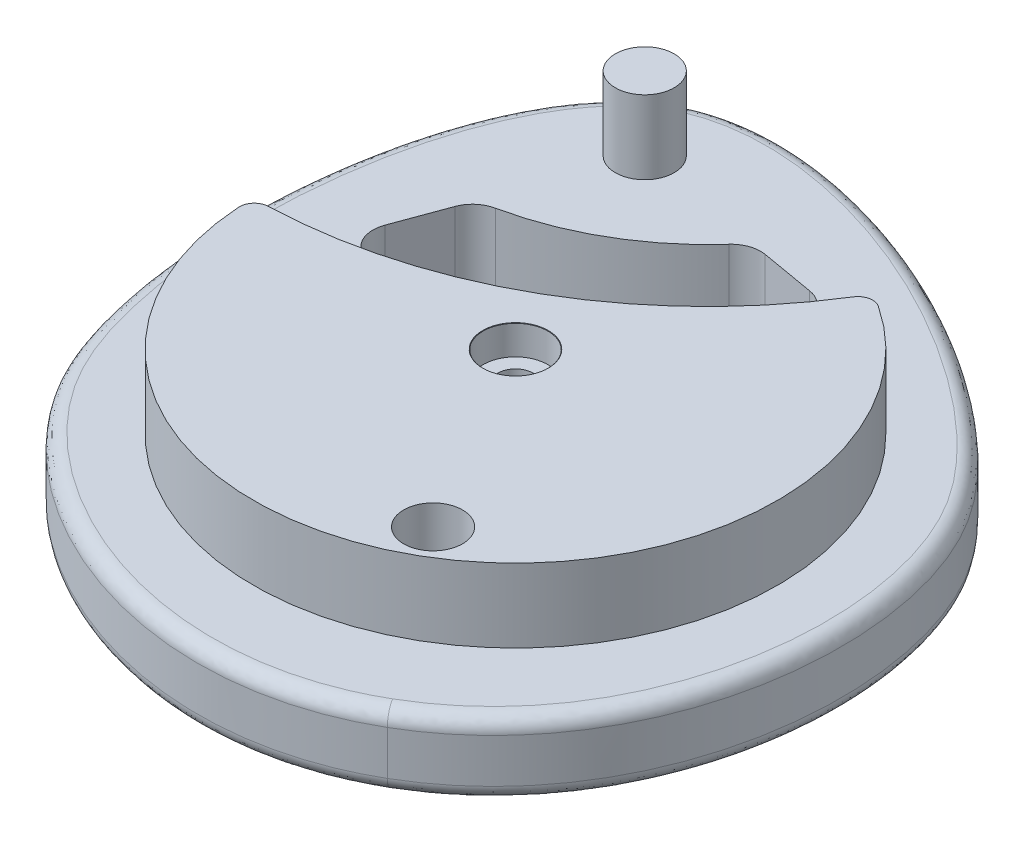
from build123d import *

# Parameters (mm, degrees)
BOSS_EXTRUDE1_DEPTH = 5
BOSS_EXTRUDE2_DEPTH = 5
SKETCH2_R           = 31
SKETCH2_R_2         = 2
CUT_EXTRUDE3_DEPTH  = 86.451740766
CUT_EXTRUDE4_DEPTH  = 77.058407391
FILLET1_R           = 2
SKETCH4_R           = 4.5
CUT_EXTRUDE7_DEPTH  = 4
FILLET2_R           = 1
FILLET5_R           = 1
FILLET6_R           = 1
CUT_EXTRUDE8_DEPTH  = 4


with BuildPart() as part:
    # Sketch1 → Boss-Extrude1 (new body)
    with BuildSketch(Plane(origin=(0, 0, 0), x_dir=(1, 0, 0), z_dir=(0, 1, 0))):
        with BuildLine():
            ThreePointArc((65.8, 0), (48, -17.8), (30.2, 0))
            Line((30.2, 0), (17, 0))
            ThreePointArc((17, 0), (48, -31), (79, 0))
            ThreePointArc((79, 0), (63.5, 26.846787517), (32.5, 26.846787517))
            Line((32.5, 26.846787517), (35, 22.516660498))
            ThreePointArc((35, 22.516660498), (37, 22.516660498), (38, 20.784609691))
            ThreePointArc((38, 20.784609691), (37.732050808, 19.784609691), (37, 19.052558883))
            Line((37, 19.052558883), (39.1, 15.415252187))
            ThreePointArc((39.1, 15.415252187), (48, 17.8), (56.9, 15.415252187))
            ThreePointArc((56.9, 15.415252187), (63.415252187, 8.9), (65.8, 0))
        make_face()
        with BuildLine():
            ThreePointArc((45.615252187, 4.130504375), (38.179521702, 1.050523962), (30.2, 0))
            Line((30.2, 0), (48, 0))
            Line((48, 0), (45.615252187, 4.130504375))
        make_face()
        with BuildLine():
            ThreePointArc((39.1, 15.415252187), (32.584747813, 8.9), (30.2, 0))
            ThreePointArc((30.2, 0), (38.179521702, 1.050523962), (45.615252187, 4.130504375))
            Line((45.615252187, 4.130504375), (39.1, 15.415252187))
        make_face()
        with BuildLine():
            ThreePointArc((56.9, 15.415252187), (48, 17.8), (39.1, 15.415252187))
            Line((39.1, 15.415252187), (45.615252187, 4.130504375))
            ThreePointArc((45.615252187, 4.130504375), (52.000458711, 9.030045664), (56.9, 15.415252187))
        make_face()
        with BuildLine():
            Line((48, 0), (30.2, 0))
            ThreePointArc((30.2, 0), (48, -17.8), (65.8, 0))
            ThreePointArc((65.8, 0), (63.415252187, 8.9), (56.9, 15.415252187))
            ThreePointArc((56.9, 15.415252187), (52.000458711, 9.030045664), (45.615252187, 4.130504375))
            Line((45.615252187, 4.130504375), (48, 0))
        make_face()
        with BuildLine():
            Line((30.2, 17.43597813), (30.2, 0))
            ThreePointArc((30.2, 0), (32.584747813, 8.9), (39.1, 15.415252187))
            Line((39.1, 15.415252187), (37, 19.052558883))
            ThreePointArc((37, 19.052558883), (35.48236191, 18.852758038), (34.267949192, 19.784609691))
            Line((34.267949192, 19.784609691), (30.2, 17.43597813))
        make_face()
        with BuildLine():
            Line((17, 0), (30.2, 0))
            Line((30.2, 0), (30.2, 17.43597813))
            Line((30.2, 17.43597813), (19.007354532, 10.973901256))
            ThreePointArc((19.007354532, 10.973901256), (17.505967719, 5.577992044), (17, 0))
        make_face()
        with BuildLine():
            Line((19.007354532, 10.973901256), (30.2, 17.43597813))
            Line((30.2, 17.43597813), (30.2, 25.380307327))
            ThreePointArc((30.2, 25.380307327), (23.51992542, 19.019094315), (19.007354532, 10.973901256))
        make_face()
        with BuildLine():
            Line((30.2, 25.380307327), (30.2, 17.43597813))
            Line((30.2, 17.43597813), (34.267949192, 19.784609691))
            ThreePointArc((34.267949192, 19.784609691), (34.068148347, 21.302247781), (35, 22.516660498))
            Line((35, 22.516660498), (32.5, 26.846787517))
            ThreePointArc((32.5, 26.846787517), (31.333862444, 26.138857262), (30.2, 25.380307327))
        make_face()
        with BuildLine():
            Line((36, 20.784609691), (37, 19.052558883))
            ThreePointArc((37, 19.052558883), (37.732050808, 19.784609691), (38, 20.784609691))
            ThreePointArc((38, 20.784609691), (37, 22.516660498), (35, 22.516660498))
            Line((35, 22.516660498), (36, 20.784609691))
        make_face()
        with BuildLine():
            ThreePointArc((35, 22.516660498), (34.068148347, 21.302247781), (34.267949192, 19.784609691))
            Line((34.267949192, 19.784609691), (36, 20.784609691))
            Line((36, 20.784609691), (35, 22.516660498))
        make_face()
        with BuildLine():
            Line((36, 20.784609691), (34.267949192, 19.784609691))
            ThreePointArc((34.267949192, 19.784609691), (35.48236191, 18.852758038), (37, 19.052558883))
            Line((37, 19.052558883), (36, 20.784609691))
        make_face()
    extrude(amount=-BOSS_EXTRUDE1_DEPTH)

    # Sketch1<3> → Boss-Extrude2 (add)
    with BuildSketch(Plane(origin=(0, 0, 0), x_dir=(1, 0, 0), z_dir=(0, 1, 0))):
        with BuildLine():
            Line((36, 20.784609691), (37, 19.052558883))
            ThreePointArc((37, 19.052558883), (37.732050808, 19.784609691), (38, 20.784609691))
            ThreePointArc((38, 20.784609691), (37, 22.516660498), (35, 22.516660498))
            Line((35, 22.516660498), (36, 20.784609691))
        make_face()
        with BuildLine():
            ThreePointArc((35, 22.516660498), (34.068148347, 21.302247781), (34.267949192, 19.784609691))
            Line((34.267949192, 19.784609691), (36, 20.784609691))
            Line((36, 20.784609691), (35, 22.516660498))
        make_face()
        with BuildLine():
            Line((36, 20.784609691), (34.267949192, 19.784609691))
            ThreePointArc((34.267949192, 19.784609691), (35.48236191, 18.852758038), (37, 19.052558883))
            Line((37, 19.052558883), (36, 20.784609691))
        make_face()
        with BuildLine():
            Line((48, 0), (30.2, 0))
            ThreePointArc((30.2, 0), (48, -17.8), (65.8, 0))
            ThreePointArc((65.8, 0), (63.415252187, 8.9), (56.9, 15.415252187))
            ThreePointArc((56.9, 15.415252187), (52.000458711, 9.030045664), (45.615252187, 4.130504375))
            Line((45.615252187, 4.130504375), (48, 0))
        make_face()
        with BuildLine():
            ThreePointArc((45.615252187, 4.130504375), (38.179521702, 1.050523962), (30.2, 0))
            Line((30.2, 0), (48, 0))
            Line((48, 0), (45.615252187, 4.130504375))
        make_face()
    extrude(amount=BOSS_EXTRUDE2_DEPTH)

    # Sketch2 → Cut-Extrude3 (cut, through all)
    # profile 1 of 2: a face of its own
    with BuildSketch(Plane.XZ.offset(5)):
        with Locations((48, 0)):
            Circle(SKETCH2_R)
        with BuildLine():
            add(Edge.make_bspline(
                [(33.5, -25.11473671), (41.005071666, -29.447791856), (59.16664363, -21.948209989), (73.251583466, -4.343665904), (71.044723717, 14.176995372), (59.9, 20.61140461)],
                knots=[0, 0, 0, 0, 0.482560149, 0.567978466, 1, 1, 1, 1], degree=3))
            add(Edge.make_bspline(
                [(33.5, -25.11473671), (25.994928334, -20.781681563), (23.408970767, -1.303507935), (31.612483249, 19.696679815), (48.755276283, 27.045813848), (59.9, 20.61140461)],
                knots=[0, 0, 0, 0, 0.482560149, 0.567978466, 1, 1, 1, 1], degree=3))
        make_face(mode=Mode.SUBTRACT)
    # profile 2 of 2: a face of its own
    with BuildSketch(Plane.XZ.offset(5)):
        with Locations(Location((55.65, 13.250188678, 0), (0, 0, 270))):
            Circle(SKETCH2_R_2)
    extrude(amount=-CUT_EXTRUDE3_DEPTH, mode=Mode.SUBTRACT)

    # Sketch2<4> → Cut-Extrude4 (cut, through all)
    with BuildSketch(Plane.XZ.offset(5)):
        with BuildLine():
            ThreePointArc((44.768063231, -19.266269264), (39.5, -14.722431864), (32.930889766, -12.432073977))
            Line((32.930889766, -12.432073977), (30.2, -5))
            ThreePointArc((30.2, -5), (43.115252187, -8.460631394), (52.569872981, -17.915252187))
            Line((52.569872981, -17.915252187), (44.768063231, -19.266269264))
        make_face()
    extrude(amount=-CUT_EXTRUDE4_DEPTH, mode=Mode.SUBTRACT)

    # Fillet1
    fillet1_edges = [part.edges().sort_by_distance(p)[0] for p in [
        (44.768063231, -2.5, -19.266269264),
        (32.930889766, -2.5, -12.432073977),
        (30.2, -2.5, -5),
        (52.569872981, -2.5, -17.915252187),
    ]]
    fillet(fillet1_edges, radius=FILLET1_R)

    # Sketch4 → Cut-Extrude7 (cut)
    with BuildSketch(Plane.XZ.offset(5)):
        with Locations(Location((48, 0, 0), (0, 0, 270))):
            Circle(SKETCH4_R)
    extrude(amount=-CUT_EXTRUDE7_DEPTH, mode=Mode.SUBTRACT)

    # Fillet2
    fillet2_edges = [part.edges().sort_by_distance(p)[0] for p in [
        (56.9, 2.5, -15.415252187),
        (30.2, 2.5, 0),
    ]]
    fillet(fillet2_edges, radius=FILLET2_R)

    # Fillet5
    fillet5_edges = [part.edges().sort_by_distance(p)[0] for p in [
        (27.872139119, -5, 9.907811799),
        (66.644347155, -5, -12.477332947),
    ]]
    fillet(fillet5_edges, radius=FILLET5_R)

    # Fillet6
    fillet6_edges = [part.edges().sort_by_distance(p)[0] for p in [
        (27.872139121, 0, 9.9078118),
        (66.644347154, 0, -12.477332945),
    ]]
    fillet(fillet6_edges, radius=FILLET6_R)

    # Sketch7 → CBORE for M2 SHCS1 (revolve, cut)
    with BuildSketch(Plane(origin=(48, 5, 0), x_dir=(0, 0, 1), z_dir=(1, 0, 0))):
        Polygon((0, 0), (0, 15.721032743), (1.2, 15), (1.2, 2), (2.2, 2), (2.2, 0.025), (2.225, 0), align=None)
    revolve(axis=Axis((48, 11.35, 0), (0, -1, 0)), mode=Mode.SUBTRACT)

    # Sketch8 → Cut-Extrude8 (cut)
    with BuildSketch(Plane.XZ.offset(5)):
        Polygon((48.383974596, 2.665063509), (50.383974596, 6.129165125), (52.116025404, 5.129165125), (50.116025404, 1.665063509), align=None)
    extrude(amount=-CUT_EXTRUDE8_DEPTH, mode=Mode.SUBTRACT)


solid = part.part
